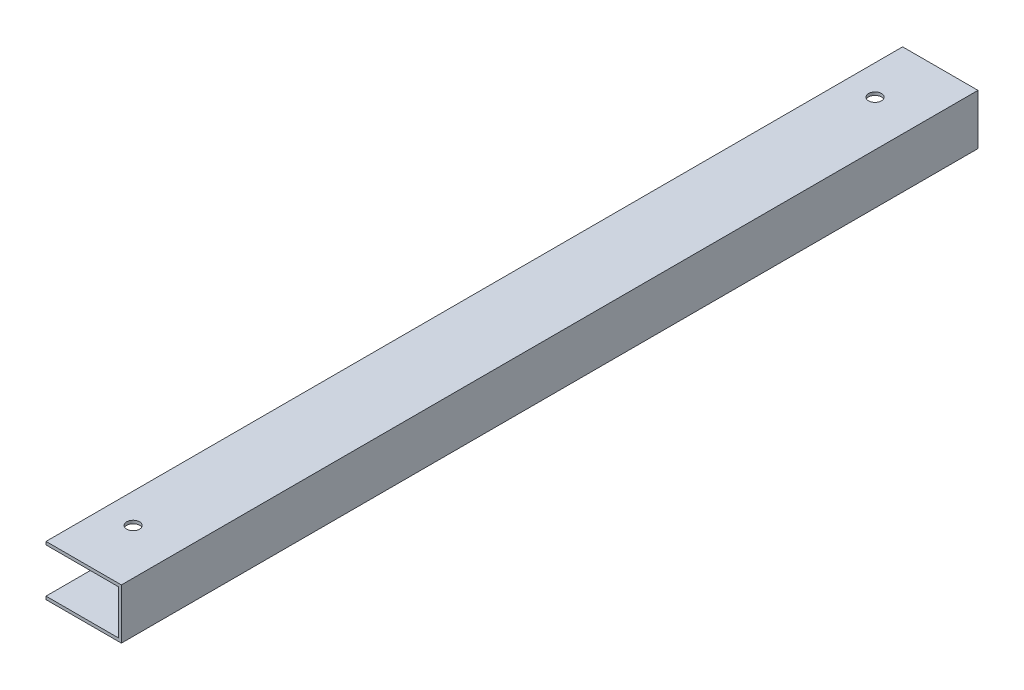
from build123d import *

# Parameters (mm, degrees)
CROQUIS2_W              = 76.2
CROQUIS2_H              = 51
SALIENTE_EXTRUIR1_DEPTH = 433
CROQUIS6_W              = 70
CROQUIS6_H              = 44.8
CORTAR_EXTRUIR1_DEPTH   = 900
CROQUIS7_W              = 866
CROQUIS7_H              = 44.8
CORTAR_EXTRUIR2_DEPTH   = 20
CROQUIS8_R              = 6.5
CORTAR_EXTRUIR3_DEPTH   = 80


with BuildPart() as part:
    # Croquis2 → Saliente-Extruir1 (new, symmetric)
    with BuildSketch(Plane.XY):
        Rectangle(CROQUIS2_W, CROQUIS2_H)
    extrude(amount=SALIENTE_EXTRUIR1_DEPTH, both=True)

    # Croquis6 → Cortar-Extruir1 (cut)
    with BuildSketch(Plane.XY.offset(433)):
        Rectangle(CROQUIS6_W, CROQUIS6_H)
    extrude(amount=-CORTAR_EXTRUIR1_DEPTH, mode=Mode.SUBTRACT)

    # Croquis7 → Cortar-Extruir2 (cut)
    with BuildSketch(Plane.ZY.offset(38.1)):
        Rectangle(CROQUIS7_W, CROQUIS7_H)
    extrude(amount=-CORTAR_EXTRUIR2_DEPTH, mode=Mode.SUBTRACT)

    # Croquis8 → Cortar-Extruir3 (cut)
    with BuildSketch(Plane(origin=(0, 25.5, 0), x_dir=(1, 0, 0), z_dir=(0, 1, 0))):
        with Locations((-8, 375)):
            Circle(CROQUIS8_R)
        with Locations((-8, -375)):
            Circle(CROQUIS8_R)
    extrude(amount=-CORTAR_EXTRUIR3_DEPTH, mode=Mode.SUBTRACT)


solid = part.part
